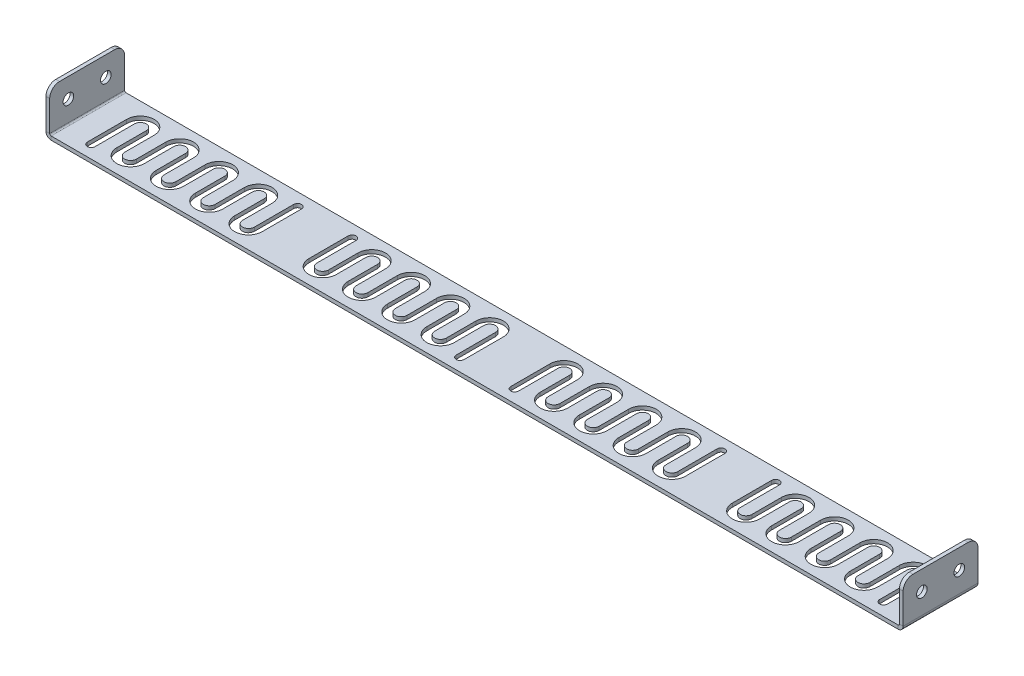
from build123d import *

# Parameters (mm, degrees)
SKETCH14_W                     = 436.240000001
SKETCH14_H                     = 38.1
BASE_FLANGE1_DEPTH             = 1.88
EDGE_FLANGE1_STRIP_W           = 8.9932
EDGE_FLANGE1_STRIP_H           = 1.88
EDGE_FLANGE1_STRIP_CUT_DEPTH   = 38.1
EDGE_FLANGE1_STRIP_2_W         = 8.9932
EDGE_FLANGE1_STRIP_2_H         = 1.88
EDGE_FLANGE1_STRIP_CUT_2_DEPTH = 38.1
EDGE_FLANGE1_DEPTH             = 38.1
EDGE_FLANGE1_BEND_DEPTH        = 38.1
SKETCH23_R                     = 2.7051
CUT_EXTRUDE1_DEPTH             = 439.411460349
FILLET1_R                      = 5
CUT_EXTRUDE3_DEPTH             = 439.411460349


# Sheet-metal steps are written as plain solids
with BuildPart() as part:
    # Sketch14 → Base-Flange1 (new body)
    with BuildSketch(Plane(origin=(0, 0, 0), x_dir=(1, 0, 0), z_dir=(0, 1, 0))):
        with Locations((218.120000001, 19.05)):
            Rectangle(SKETCH14_W, SKETCH14_H)
    extrude(amount=-BASE_FLANGE1_DEPTH)

    # Edge-Flange1 strip (across the edge) → Edge-Flange1 strip cut (cut)
    with BuildSketch(Plane.XY.offset(-38.1)):
        with Locations((-1.88, -0.94)):
            Rectangle(EDGE_FLANGE1_STRIP_W, EDGE_FLANGE1_STRIP_H)
    extrude(amount=EDGE_FLANGE1_STRIP_CUT_DEPTH, mode=Mode.SUBTRACT)

    # Edge-Flange1 strip 2 (across the edge) → Edge-Flange1 strip cut 2 (cut)
    with BuildSketch(Plane(origin=(436.240000001, 0, 0), x_dir=(-1, 0, 0), z_dir=(0, 0, -1))):
        with Locations((-1.88, -0.94)):
            Rectangle(EDGE_FLANGE1_STRIP_2_W, EDGE_FLANGE1_STRIP_2_H)
    extrude(amount=EDGE_FLANGE1_STRIP_CUT_2_DEPTH, mode=Mode.SUBTRACT)

    # Edge-Flange1 section (across the edge) → Edge-Flange1 (add)
    with BuildSketch(Plane.XY.offset(-38.1)):
        with BuildLine():
            Line((0, 0.7366), (0, 21.158))
            Line((0, 21.158), (1.88, 21.158))
            Line((1.88, 21.158), (1.88, 0.7366))
            ThreePointArc((1.88, 0.7366), (2.095745145, 0.215745145), (2.6166, 0))
            Line((2.6166, 0), (2.6166, -1.88))
            ThreePointArc((2.6166, -1.88), (0.766384396, -1.113615604), (0, 0.7366))
        make_face()
    extrude(amount=EDGE_FLANGE1_DEPTH)

    # Edge-Flange1 section 2 (across the edge) → Edge-Flange1 bend (add)
    with BuildSketch(Plane(origin=(436.240000001, 0, 0), x_dir=(-1, 0, 0), z_dir=(0, 0, -1))):
        with BuildLine():
            Line((0, 0.7366), (0, 21.158))
            Line((0, 21.158), (1.88, 21.158))
            Line((1.88, 21.158), (1.88, 0.7366))
            ThreePointArc((1.88, 0.7366), (2.095745145, 0.215745145), (2.6166, 0))
            Line((2.6166, 0), (2.6166, -1.88))
            ThreePointArc((2.6166, -1.88), (0.766384396, -1.113615604), (0, 0.7366))
        make_face()
    extrude(amount=EDGE_FLANGE1_BEND_DEPTH)

    # Sketch23 → Cut-Extrude1 (cut, through all)
    with BuildSketch(Plane.ZY):
        with Locations(Location((-28.575, 11.158, 0), (0, 0, 270))):
            Circle(SKETCH23_R)
        with Locations(Location((-9.525, 11.158, 0), (0, 0, 270))):
            Circle(SKETCH23_R)
    extrude(amount=-CUT_EXTRUDE1_DEPTH, mode=Mode.SUBTRACT)

    # Fillet1
    fillet1_edges = [part.edges().sort_by_distance(p)[0] for p in [
        (0.94, 21.158, -38.1),
        (0.94, 21.158, 0),
        (435.300000001, 21.158, 0),
        (435.300000001, 21.158, -38.1),
    ]]
    fillet(fillet1_edges, radius=FILLET1_R)

    # Sketch25 → Cut-Extrude3 (cut, through all)
    with BuildSketch(Plane(origin=(0, 0, 0), x_dir=(1, 0, 0), z_dir=(0, 1, 0))):
        with BuildLine():
            Line((94.49245, 31.55), (94.49245, 26.55))
            Line((94.49245, 26.55), (94.49245, 11.55))
            ThreePointArc((94.49245, 11.55), (91.49245, 8.55), (88.49245, 11.55))
            Line((88.49245, 11.55), (88.49245, 26.55))
            ThreePointArc((88.49245, 26.55), (81.49245, 33.55), (74.49245, 26.55))
            Line((74.49245, 26.55), (74.49245, 11.55))
            ThreePointArc((74.49245, 11.55), (71.49245, 8.55), (68.49245, 11.55))
            Line((68.49245, 11.55), (68.49245, 26.55))
            ThreePointArc((68.49245, 26.55), (61.49245, 33.55), (54.49245, 26.55))
            Line((54.49245, 26.55), (54.49245, 11.55))
            ThreePointArc((54.49245, 11.55), (51.49245, 8.55), (48.49245, 11.55))
            Line((48.49245, 11.55), (48.49245, 26.55))
            ThreePointArc((48.49245, 26.55), (41.49245, 33.55), (34.49245, 26.55))
            Line((34.49245, 26.55), (34.49245, 11.55))
            ThreePointArc((34.49245, 11.55), (31.49245, 8.55), (28.49245, 11.55))
            Line((28.49245, 11.55), (28.49245, 26.55))
            ThreePointArc((28.49245, 26.55), (21.49245, 33.55), (14.49245, 26.55))
            Line((14.49245, 26.55), (14.49245, 11.55))
            Line((14.49245, 11.55), (14.49245, 6.55))
            ThreePointArc((14.49245, 6.55), (16.49245, 4.55), (18.49245, 6.55))
            Line((18.49245, 6.55), (18.49245, 11.55))
            Line((18.49245, 11.55), (18.49245, 26.55))
            ThreePointArc((18.49245, 26.55), (21.49245, 29.55), (24.49245, 26.55))
            Line((24.49245, 26.55), (24.49245, 11.55))
            ThreePointArc((24.49245, 11.55), (31.49245, 4.55), (38.49245, 11.55))
            Line((38.49245, 11.55), (38.49245, 26.55))
            ThreePointArc((38.49245, 26.55), (41.49245, 29.55), (44.49245, 26.55))
            Line((44.49245, 26.55), (44.49245, 11.55))
            ThreePointArc((44.49245, 11.55), (51.49245, 4.55), (58.49245, 11.55))
            Line((58.49245, 11.55), (58.49245, 26.55))
            ThreePointArc((58.49245, 26.55), (61.49245, 29.55), (64.49245, 26.55))
            Line((64.49245, 26.55), (64.49245, 11.55))
            ThreePointArc((64.49245, 11.55), (71.49245, 4.55), (78.49245, 11.55))
            Line((78.49245, 11.55), (78.49245, 26.55))
            ThreePointArc((78.49245, 26.55), (81.49245, 29.55), (84.49245, 26.55))
            Line((84.49245, 26.55), (84.49245, 11.55))
            ThreePointArc((84.49245, 11.55), (91.49245, 4.55), (98.49245, 11.55))
            Line((98.49245, 11.55), (98.49245, 26.55))
            Line((98.49245, 26.55), (98.49245, 31.55))
            ThreePointArc((98.49245, 31.55), (96.49245, 33.55), (94.49245, 31.55))
        make_face()
        with BuildLine():
            Line((126.24415, 31.55), (126.24415, 26.55))
            Line((126.24415, 26.55), (126.24415, 11.55))
            ThreePointArc((126.24415, 11.55), (129.24415, 8.55), (132.24415, 11.55))
            Line((132.24415, 11.55), (132.24415, 26.55))
            ThreePointArc((132.24415, 26.55), (139.24415, 33.55), (146.24415, 26.55))
            Line((146.24415, 26.55), (146.24415, 11.55))
            ThreePointArc((146.24415, 11.55), (149.24415, 8.55), (152.24415, 11.55))
            Line((152.24415, 11.55), (152.24415, 26.55))
            ThreePointArc((152.24415, 26.55), (159.24415, 33.55), (166.24415, 26.55))
            Line((166.24415, 26.55), (166.24415, 11.55))
            ThreePointArc((166.24415, 11.55), (169.24415, 8.55), (172.24415, 11.55))
            Line((172.24415, 11.55), (172.24415, 26.55))
            ThreePointArc((172.24415, 26.55), (179.24415, 33.55), (186.24415, 26.55))
            Line((186.24415, 26.55), (186.24415, 11.55))
            ThreePointArc((186.24415, 11.55), (189.24415, 8.55), (192.24415, 11.55))
            Line((192.24415, 11.55), (192.24415, 26.55))
            ThreePointArc((192.24415, 26.55), (199.24415, 33.55), (206.24415, 26.55))
            Line((206.24415, 26.55), (206.24415, 11.55))
            Line((206.24415, 11.55), (206.24415, 6.55))
            ThreePointArc((206.24415, 6.55), (204.24415, 4.55), (202.24415, 6.55))
            Line((202.24415, 6.55), (202.24415, 11.55))
            Line((202.24415, 11.55), (202.24415, 26.55))
            ThreePointArc((202.24415, 26.55), (199.24415, 29.55), (196.24415, 26.55))
            Line((196.24415, 26.55), (196.24415, 11.55))
            ThreePointArc((196.24415, 11.55), (189.24415, 4.55), (182.24415, 11.55))
            Line((182.24415, 11.55), (182.24415, 26.55))
            ThreePointArc((182.24415, 26.55), (179.24415, 29.55), (176.24415, 26.55))
            Line((176.24415, 26.55), (176.24415, 11.55))
            ThreePointArc((176.24415, 11.55), (169.24415, 4.55), (162.24415, 11.55))
            Line((162.24415, 11.55), (162.24415, 26.55))
            ThreePointArc((162.24415, 26.55), (159.24415, 29.55), (156.24415, 26.55))
            Line((156.24415, 26.55), (156.24415, 11.55))
            ThreePointArc((156.24415, 11.55), (149.24415, 4.55), (142.24415, 11.55))
            Line((142.24415, 11.55), (142.24415, 26.55))
            ThreePointArc((142.24415, 26.55), (139.24415, 29.55), (136.24415, 26.55))
            Line((136.24415, 26.55), (136.24415, 11.55))
            ThreePointArc((136.24415, 11.55), (129.24415, 4.55), (122.24415, 11.55))
            Line((122.24415, 11.55), (122.24415, 26.55))
            Line((122.24415, 26.55), (122.24415, 31.55))
            ThreePointArc((122.24415, 31.55), (124.24415, 33.55), (126.24415, 31.55))
        make_face()
        with BuildLine():
            Line((309.995850001, 31.55), (309.995850001, 26.55))
            Line((309.995850001, 26.55), (309.995850001, 11.55))
            ThreePointArc((309.995850001, 11.55), (306.995850001, 8.55), (303.995850001, 11.55))
            Line((303.995850001, 11.55), (303.995850001, 26.55))
            ThreePointArc((303.995850001, 26.55), (296.995850001, 33.55), (289.995850001, 26.55))
            Line((289.995850001, 26.55), (289.995850001, 11.55))
            ThreePointArc((289.995850001, 11.55), (286.995850001, 8.55), (283.995850001, 11.55))
            Line((283.995850001, 11.55), (283.995850001, 26.55))
            ThreePointArc((283.995850001, 26.55), (276.995850001, 33.55), (269.995850001, 26.55))
            Line((269.995850001, 26.55), (269.995850001, 11.55))
            ThreePointArc((269.995850001, 11.55), (266.995850001, 8.55), (263.995850001, 11.55))
            Line((263.995850001, 11.55), (263.995850001, 26.55))
            ThreePointArc((263.995850001, 26.55), (256.995850001, 33.55), (249.995850001, 26.55))
            Line((249.995850001, 26.55), (249.995850001, 11.55))
            ThreePointArc((249.995850001, 11.55), (246.995850001, 8.55), (243.995850001, 11.55))
            Line((243.995850001, 11.55), (243.995850001, 26.55))
            ThreePointArc((243.995850001, 26.55), (236.995850001, 33.55), (229.995850001, 26.55))
            Line((229.995850001, 26.55), (229.995850001, 11.55))
            Line((229.995850001, 11.55), (229.995850001, 6.55))
            ThreePointArc((229.995850001, 6.55), (231.995850001, 4.55), (233.995850001, 6.55))
            Line((233.995850001, 6.55), (233.995850001, 11.55))
            Line((233.995850001, 11.55), (233.995850001, 26.55))
            ThreePointArc((233.995850001, 26.55), (236.995850001, 29.55), (239.995850001, 26.55))
            Line((239.995850001, 26.55), (239.995850001, 11.55))
            ThreePointArc((239.995850001, 11.55), (246.995850001, 4.55), (253.995850001, 11.55))
            Line((253.995850001, 11.55), (253.995850001, 26.55))
            ThreePointArc((253.995850001, 26.55), (256.995850001, 29.55), (259.995850001, 26.55))
            Line((259.995850001, 26.55), (259.995850001, 11.55))
            ThreePointArc((259.995850001, 11.55), (266.995850001, 4.55), (273.995850001, 11.55))
            Line((273.995850001, 11.55), (273.995850001, 26.55))
            ThreePointArc((273.995850001, 26.55), (276.995850001, 29.55), (279.995850001, 26.55))
            Line((279.995850001, 26.55), (279.995850001, 11.55))
            ThreePointArc((279.995850001, 11.55), (286.995850001, 4.55), (293.995850001, 11.55))
            Line((293.995850001, 11.55), (293.995850001, 26.55))
            ThreePointArc((293.995850001, 26.55), (296.995850001, 29.55), (299.995850001, 26.55))
            Line((299.995850001, 26.55), (299.995850001, 11.55))
            ThreePointArc((299.995850001, 11.55), (306.995850001, 4.55), (313.995850001, 11.55))
            Line((313.995850001, 11.55), (313.995850001, 26.55))
            Line((313.995850001, 26.55), (313.995850001, 31.55))
            ThreePointArc((313.995850001, 31.55), (311.995850001, 33.55), (309.995850001, 31.55))
        make_face()
        with BuildLine():
            Line((341.747550001, 31.55), (341.747550001, 26.55))
            Line((341.747550001, 26.55), (341.747550001, 11.55))
            ThreePointArc((341.747550001, 11.55), (344.747550001, 8.55), (347.747550001, 11.55))
            Line((347.747550001, 11.55), (347.747550001, 26.55))
            ThreePointArc((347.747550001, 26.55), (354.747550001, 33.55), (361.747550001, 26.55))
            Line((361.747550001, 26.55), (361.747550001, 11.55))
            ThreePointArc((361.747550001, 11.55), (364.747550001, 8.55), (367.747550001, 11.55))
            Line((367.747550001, 11.55), (367.747550001, 26.55))
            ThreePointArc((367.747550001, 26.55), (374.747550001, 33.55), (381.747550001, 26.55))
            Line((381.747550001, 26.55), (381.747550001, 11.55))
            ThreePointArc((381.747550001, 11.55), (384.747550001, 8.55), (387.747550001, 11.55))
            Line((387.747550001, 11.55), (387.747550001, 26.55))
            ThreePointArc((387.747550001, 26.55), (394.747550001, 33.55), (401.747550001, 26.55))
            Line((401.747550001, 26.55), (401.747550001, 11.55))
            ThreePointArc((401.747550001, 11.55), (404.747550001, 8.55), (407.747550001, 11.55))
            Line((407.747550001, 11.55), (407.747550001, 26.55))
            ThreePointArc((407.747550001, 26.55), (414.747550001, 33.55), (421.747550001, 26.55))
            Line((421.747550001, 26.55), (421.747550001, 11.55))
            Line((421.747550001, 11.55), (421.747550001, 6.55))
            ThreePointArc((421.747550001, 6.55), (419.747550001, 4.55), (417.747550001, 6.55))
            Line((417.747550001, 6.55), (417.747550001, 11.55))
            Line((417.747550001, 11.55), (417.747550001, 26.55))
            ThreePointArc((417.747550001, 26.55), (414.747550001, 29.55), (411.747550001, 26.55))
            Line((411.747550001, 26.55), (411.747550001, 11.55))
            ThreePointArc((411.747550001, 11.55), (404.747550001, 4.55), (397.747550001, 11.55))
            Line((397.747550001, 11.55), (397.747550001, 26.55))
            ThreePointArc((397.747550001, 26.55), (394.747550001, 29.55), (391.747550001, 26.55))
            Line((391.747550001, 26.55), (391.747550001, 11.55))
            ThreePointArc((391.747550001, 11.55), (384.747550001, 4.55), (377.747550001, 11.55))
            Line((377.747550001, 11.55), (377.747550001, 26.55))
            ThreePointArc((377.747550001, 26.55), (374.747550001, 29.55), (371.747550001, 26.55))
            Line((371.747550001, 26.55), (371.747550001, 11.55))
            ThreePointArc((371.747550001, 11.55), (364.747550001, 4.55), (357.747550001, 11.55))
            Line((357.747550001, 11.55), (357.747550001, 26.55))
            ThreePointArc((357.747550001, 26.55), (354.747550001, 29.55), (351.747550001, 26.55))
            Line((351.747550001, 26.55), (351.747550001, 11.55))
            ThreePointArc((351.747550001, 11.55), (344.747550001, 4.55), (337.747550001, 11.55))
            Line((337.747550001, 11.55), (337.747550001, 26.55))
            Line((337.747550001, 26.55), (337.747550001, 31.55))
            ThreePointArc((337.747550001, 31.55), (339.747550001, 33.55), (341.747550001, 31.55))
        make_face()
    extrude(amount=-CUT_EXTRUDE3_DEPTH, mode=Mode.SUBTRACT)


solid = part.part
